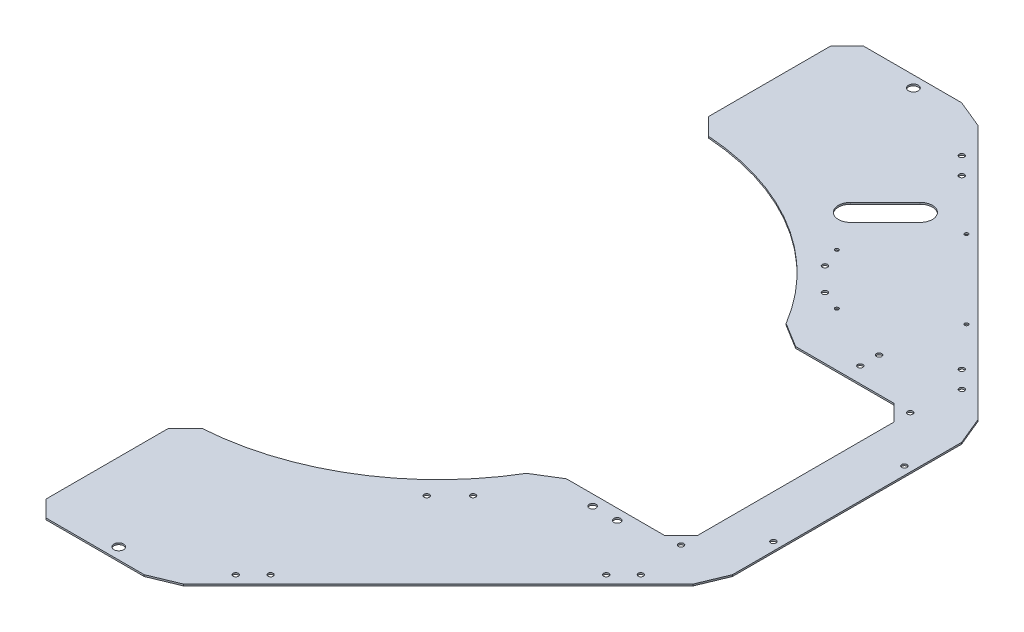
from build123d import *

# Parameters (mm, degrees)
EXTRUDE_1_DEPTH     = 1
SKETCH_2_W          = 80
SKETCH_2_H          = 140
CUT_EXTRUDE_1_DEPTH = 10
CHAMFER_1_SIZE      = 10
SKETCH_3_R          = 1.6
CUT_EXTRUDE_2_DEPTH = 10
SKETCH_4_R          = 2.1
SKETCH_4_R_2        = 1.6
CUT_EXTRUDE_3_DEPTH = 10
SKETCH_5_R          = 3
CUT_EXTRUDE_4_DEPTH = 10
SKETCH_6_R          = 1.6
CUT_EXTRUDE_5_DEPTH = 4
SKETCH_7_R          = 1.6
CUT_EXTRUDE_6_DEPTH = 4
SKETCH_9_R          = 1.1
CUT_EXTRUDE_7_DEPTH = 10


with BuildPart() as part:
    # 草图1 → 凸台-拉伸1 (new body)
    with BuildSketch(Plane(origin=(0, 0, 0), x_dir=(1, 0, 0), z_dir=(0, 1, 0))):
        with BuildLine():
            Line((0, 249.705627485), (0, 155))
            ThreePointArc((0, 155), (109.601551084, 109.601551084), (155, 0))
            ThreePointArc((155, 0), (109.601551084, -109.601551084), (0, -155))
            Line((0, -155), (0, -249.705627485))
            Line((0, -249.705627485), (80, -249.705627485))
            Line((80, -249.705627485), (249.705627485, -80))
            Line((249.705627485, -80), (249.705627485, 0))
            Line((249.705627485, 0), (249.705627485, 80))
            Line((249.705627485, 80), (80, 249.705627485))
            Line((80, 249.705627485), (0, 249.705627485))
        make_face()
    extrude(amount=EXTRUDE_1_DEPTH)

    # 草图2 → 切除-拉伸1 (cut)
    with BuildSketch(Plane(origin=(0, 1, 0), x_dir=(1, 0, 0), z_dir=(0, 1, 0))):
        with Locations((178.293166859, 0)):
            Rectangle(SKETCH_2_W, SKETCH_2_H)
    extrude(amount=-CUT_EXTRUDE_1_DEPTH, mode=Mode.SUBTRACT)

    # 倒角1
    # the kernel refuses this chamfer: 10 mm, written as the material it adds along each edge
    with BuildSketch(Plane(origin=(218.293166859, 1, -70), x_dir=(0, 0, 1), z_dir=(0, -1, 0)), Plane(origin=(218.293166859, 1, 70), x_dir=(-1, 0, 0), z_dir=(0, -1, 0))) as chamfer_1_piece_1:
        Polygon((CHAMFER_1_SIZE, 0), (0, CHAMFER_1_SIZE), (0, 0), align=None)
    extrude(amount=1)
    # the kernel refuses this chamfer: 10 mm, written as the material it takes off along each edge
    with BuildSketch(Plane(origin=(0, -26.617651024, -155), x_dir=(0.9994423420060535, 0, 0.0333916906648138), z_dir=(0, 1, 0))) as chamfer_1_2_piece_1:
        with BuildLine():
            Line((10.351424106, 0), (-CHAMFER_1_SIZE * 0.0333916906648, CHAMFER_1_SIZE * 0.999442342006))
            Line((-CHAMFER_1_SIZE * 0.0333916906648, CHAMFER_1_SIZE * 0.999442342006), (0, 0))
            ThreePointArc((0, 0), (5.321987279, 0.086367968), (10.351424106, 0))
        make_face()
    extrude(amount=54.235302047, mode=Mode.SUBTRACT)
    with BuildSketch(Plane(origin=(0, -25.71682988, -249.705627485), x_dir=(0, 0, 1), z_dir=(0, 1, 0))) as chamfer_1_2_piece_2:
        Polygon((CHAMFER_1_SIZE, 0), (0, CHAMFER_1_SIZE), (0, 0), align=None)
    extrude(amount=52.433659759, mode=Mode.SUBTRACT)
    with BuildSketch(Plane(origin=(80, -25.926703929, -249.705627485), x_dir=(-1, 0, 0), z_dir=(0, 1, 0)), Plane(origin=(249.705627485, -25.926703929, -80), x_dir=(-0.7071067811865482, 0, -0.7071067811865468), z_dir=(0, 1, 0))) as chamfer_1_2_piece_3:
        Polygon((CHAMFER_1_SIZE, 0), (-CHAMFER_1_SIZE * 0.707106781187, CHAMFER_1_SIZE * 0.707106781187), (0, 0), align=None)
    extrude(amount=52.853407858, mode=Mode.SUBTRACT)
    with BuildSketch(Plane(origin=(249.705627485, -25.926703929, 80), x_dir=(-0.7071067811865481, 0, 0.7071067811865468), z_dir=(0, 1, 0)), Plane(origin=(80, -25.926703929, 249.705627485), x_dir=(-1, 0, 0), z_dir=(0, 1, 0))) as chamfer_1_2_piece_4:
        Polygon((CHAMFER_1_SIZE, 0), (-CHAMFER_1_SIZE * 0.707106781187, -CHAMFER_1_SIZE * 0.707106781187), (0, 0), align=None)
    extrude(amount=52.853407858, mode=Mode.SUBTRACT)
    with BuildSketch(Plane(origin=(0, -25.71682988, 249.705627485), x_dir=(0, 0, -1), z_dir=(0, 1, 0))) as chamfer_1_2_piece_5:
        Polygon((CHAMFER_1_SIZE, 0), (0, -CHAMFER_1_SIZE), (0, 0), align=None)
    extrude(amount=52.433659759, mode=Mode.SUBTRACT)
    with BuildSketch(Plane(origin=(0, -26.617651024, 155), x_dir=(0, 0, 1), z_dir=(0, 1, 0))) as chamfer_1_2_piece_6:
        with BuildLine():
            Line((CHAMFER_1_SIZE, 0), (-0.345651552, 10.345651552))
            ThreePointArc((-0.345651552, 10.345651552), (-0.091390348, 5.321903403), (0, 0))
            Line((0, 0), (CHAMFER_1_SIZE, 0))
        make_face()
    extrude(amount=54.235302047, mode=Mode.SUBTRACT)
    with BuildSketch(Plane(origin=(138.293166859, 28.362248577, -70), x_dir=(1, 0, 0), z_dir=(0, -1, 0))) as chamfer_1_2_piece_7:
        with BuildLine():
            Line((CHAMFER_1_SIZE, 0), (-5.105315746, -9.284275337))
            ThreePointArc((-5.105315746, -9.284275337), (-2.557269233, -4.838266251), (0, 0))
            Line((0, 0), (CHAMFER_1_SIZE, 0))
        make_face()
    extrude(amount=55.724497155, mode=Mode.SUBTRACT)
    with BuildSketch(Plane(origin=(138.293166859, 28.362248577, 70), x_dir=(-0.4818437006338934, 0, 0.8762571815166109), z_dir=(0, -1, 0))) as chamfer_1_2_piece_8:
        with BuildLine():
            Line((10.595377171, 0), (-CHAMFER_1_SIZE * 0.481843700634, -CHAMFER_1_SIZE * 0.876257181517))
            Line((-CHAMFER_1_SIZE * 0.481843700634, -CHAMFER_1_SIZE * 0.876257181517), (0, 0))
            ThreePointArc((0, 0), (5.471769619, -0.090462585), (10.595377171, 0))
        make_face()
    extrude(amount=55.724497155, mode=Mode.SUBTRACT)

    # 草图3 → 切除-拉伸2 (cut)
    with BuildSketch(Plane(origin=(0, 1, 0), x_dir=(1, 0, 0), z_dir=(0, 1, 0))):
        with Locations(Location((98.03122292, -221.774909628, 0), (0, 0, 270))):
            Circle(SKETCH_3_R)
        with Locations(Location((108.637824638, -211.16830791, 0), (0, 0, 270))):
            Circle(SKETCH_3_R)
        with Locations(Location((211.16830791, -108.637824638, 0), (0, 0, 270))):
            Circle(SKETCH_3_R)
        with Locations(Location((221.774909628, -98.03122292, 0), (0, 0, 270))):
            Circle(SKETCH_3_R)
        with Locations(Location((244.705627485, -40, 0), (0, 0, 270))):
            Circle(SKETCH_3_R)
        with Locations(Location((244.705627485, 40, 0), (0, 0, 270))):
            Circle(SKETCH_3_R)
        with Locations(Location((221.774909628, 98.03122292, 0), (0, 0, 270))):
            Circle(SKETCH_3_R)
        with Locations(Location((211.16830791, 108.637824638, 0), (0, 0, 270))):
            Circle(SKETCH_3_R)
        with Locations(Location((108.637824638, 211.16830791, 0), (0, 0, 270))):
            Circle(SKETCH_3_R)
        with Locations(Location((98.03122292, 221.774909628, 0), (0, 0, 270))):
            Circle(SKETCH_3_R)
    extrude(amount=-CUT_EXTRUDE_2_DEPTH, mode=Mode.SUBTRACT)

    # 草图4 → 切除-拉伸3 (cut)
    with BuildSketch(Plane(origin=(0, 1, 0), x_dir=(1, 0, 0), z_dir=(0, 1, 0))):
        with Locations(Location((170.793166859, -76.5, 0), (0, 0, 270))):
            Circle(SKETCH_4_R)
        with Locations(Location((185.793166859, -76.5, 0), (0, 0, 270))):
            Circle(SKETCH_4_R)
        with Locations(Location((178.293166859, 91, 0), (0, 0, 270))):
            Circle(SKETCH_4_R_2)
        with Locations(Location((178.293166859, 79.5, 0), (0, 0, 270))):
            Circle(SKETCH_4_R_2)
    extrude(amount=-CUT_EXTRUDE_3_DEPTH, mode=Mode.SUBTRACT)

    # 草图5 → 切除-拉伸4 (cut)
    with BuildSketch(Plane(origin=(0, 1, 0), x_dir=(1, 0, 0), z_dir=(0, 1, 0))):
        with Locations(Location((47.5, -242.75, 0), (0, 0, 270))):
            Circle(SKETCH_5_R)
        with Locations(Location((47.5, 242.75, 0), (0, 0, 270))):
            Circle(SKETCH_5_R)
    extrude(amount=-CUT_EXTRUDE_4_DEPTH, mode=Mode.SUBTRACT)

    # 草图6 → 切除-拉伸5 (cut)
    with BuildSketch(Plane(origin=(0, 1, 0), x_dir=(1, 0, 0), z_dir=(0, 1, 0))):
        with Locations(Location((128.699747468, 107.486544033, 0), (0, 0, 270))):
            Circle(SKETCH_6_R)
        with Locations(Location((114.557611845, 121.628679656, 0), (0, 0, 270))):
            Circle(SKETCH_6_R)
        with Locations(Location((128.699747468, -107.486544033, 0), (0, 0, 270))):
            Circle(SKETCH_6_R)
        with Locations(Location((114.557611845, -121.628679656, 0), (0, 0, 270))):
            Circle(SKETCH_6_R)
    extrude(amount=-CUT_EXTRUDE_5_DEPTH, mode=Mode.SUBTRACT)

    # 草图7 → 切除-拉伸6 (cut)
    with BuildSketch(Plane(origin=(0, 1, 0), x_dir=(1, 0, 0), z_dir=(0, 1, 0))):
        with Locations(Location((218.293166859, 70, 0), (0, 0, 270))):
            Circle(SKETCH_7_R)
        with Locations(Location((218.293166859, -70, 0), (0, 0, 270))):
            Circle(SKETCH_7_R)
    extrude(amount=-CUT_EXTRUDE_6_DEPTH, mode=Mode.SUBTRACT)

    # 草图9 → 切除-拉伸7 (cut)
    with BuildSketch(Plane(origin=(0, 1, 0), x_dir=(1, 0, 0), z_dir=(0, 1, 0))):
        with Locations(Location((188.717667607, 133.916892065, 0), (0, 0, 270))):
            Circle(SKETCH_9_R)
        with Locations(Location((140.987959877, 181.646599796, 0), (0, 0, 270))):
            Circle(SKETCH_9_R)
        with Locations(Location((109.69848481, 133.74011537, 0), (0, 0, 270))):
            Circle(SKETCH_9_R)
        with Locations(Location((140.811183182, 102.627416998, 0), (0, 0, 270))):
            Circle(SKETCH_9_R)
        with BuildLine():
            Line((88.838834765, 163.085046789), (110.0520382, 184.298250225))
            ThreePointArc((110.0520382, 184.298250225), (120.658639918, 184.298250225), (120.658639918, 173.691648507))
            Line((120.658639918, 173.691648507), (99.445436483, 152.478445072))
            ThreePointArc((99.445436483, 152.478445072), (88.838834765, 152.478445072), (88.838834765, 163.085046789))
        make_face()
    extrude(amount=-CUT_EXTRUDE_7_DEPTH, mode=Mode.SUBTRACT)


solid = part.part
